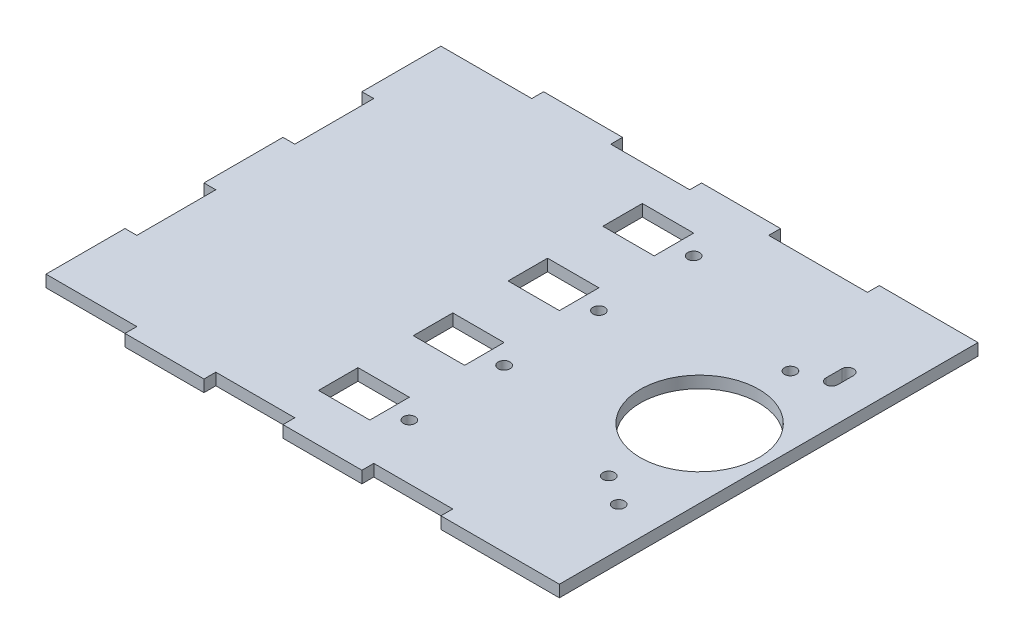
from build123d import *

# Parameters (mm, degrees)
SKETCH1_W            = 130
SKETCH1_H            = 100
BOSS_EXTRUDE1_DEPTH  = 3
SKETCH2_W            = 30
SKETCH2_H            = 3
BOSS_EXTRUDE2_DEPTH  = 3
SKETCH4_W            = 20
SKETCH4_H            = 3
BOSS_EXTRUDE3_DEPTH  = 3
SKETCH5_W            = 20
SKETCH5_H            = 3
BOSS_EXTRUDE4_DEPTH  = 3
SKETCH6_W            = 20
SKETCH6_H            = 3
BOSS_EXTRUDE5_DEPTH  = 3
SKETCH7_W            = 20
SKETCH7_H            = 3
BOSS_EXTRUDE6_DEPTH  = 3
SKETCH8_W            = 20
SKETCH8_H            = 3
BOSS_EXTRUDE7_DEPTH  = 3
SKETCH9_W            = 20
SKETCH9_H            = 3
BOSS_EXTRUDE8_DEPTH  = 3
SKETCH10_W           = 20
SKETCH10_H           = 3
BOSS_EXTRUDE9_DEPTH  = 3
SKETCH11_W           = 25
SKETCH11_H           = 3
BOSS_EXTRUDE10_DEPTH = 3
CUT_EXTRUDE1_DEPTH   = 0.5
SKETCH18_R           = 1.5
CUT_EXTRUDE2_DEPTH   = 10
SKETCH19_R           = 1.5
CUT_EXTRUDE3_DEPTH   = 10
SKETCH30_R           = 15
CUT_EXTRUDE9_DEPTH   = 3
SKETCH32_W           = 13
SKETCH32_H           = 10
CUT_EXTRUDE11_DEPTH  = 10
SKETCH34_R           = 1.5
CUT_EXTRUDE12_DEPTH  = 10
SKETCH35_R           = 1.5
CUT_EXTRUDE13_DEPTH  = 10


with BuildPart() as part:
    # Sketch1 → Boss-Extrude1 (new body)
    with BuildSketch(Plane(origin=(0, 0, 0), x_dir=(1, 0, 0), z_dir=(0, 1, 0))):
        with Locations((65, 50)):
            Rectangle(SKETCH1_W, SKETCH1_H)
    extrude(amount=BOSS_EXTRUDE1_DEPTH)

    # Sketch2 → Boss-Extrude2 (add)
    with BuildSketch(Plane.XY):
        with Locations((115, 1.5)):
            Rectangle(SKETCH2_W, SKETCH2_H)
    extrude(amount=BOSS_EXTRUDE2_DEPTH)

    # Sketch4 → Boss-Extrude3 (add)
    with BuildSketch(Plane.XY):
        with Locations((70, 1.5)):
            Rectangle(SKETCH4_W, SKETCH4_H)
    extrude(amount=BOSS_EXTRUDE3_DEPTH)

    # Sketch5 → Boss-Extrude4 (add)
    with BuildSketch(Plane.XY):
        with Locations((30, 1.5)):
            Rectangle(SKETCH5_W, SKETCH5_H)
    extrude(amount=BOSS_EXTRUDE4_DEPTH)

    # Sketch6 → Boss-Extrude5 (add)
    with BuildSketch(Plane.ZY):
        with Locations((-10, 1.5)):
            Rectangle(SKETCH6_W, SKETCH6_H)
    extrude(amount=BOSS_EXTRUDE5_DEPTH)

    # Sketch7 → Boss-Extrude6 (add)
    with BuildSketch(Plane.ZY):
        with Locations((-50, 1.5)):
            Rectangle(SKETCH7_W, SKETCH7_H)
    extrude(amount=BOSS_EXTRUDE6_DEPTH)

    # Sketch8 → Boss-Extrude7 (add)
    with BuildSketch(Plane.ZY):
        with Locations((-90, 1.5)):
            Rectangle(SKETCH8_W, SKETCH8_H)
    extrude(amount=BOSS_EXTRUDE7_DEPTH)

    # Sketch9 → Boss-Extrude8 (add)
    with BuildSketch(Plane(origin=(0, 0, -100), x_dir=(-1, 0, 0), z_dir=(0, 0, -1))):
        with Locations((-30, 1.5)):
            Rectangle(SKETCH9_W, SKETCH9_H)
    extrude(amount=BOSS_EXTRUDE8_DEPTH)

    # Sketch10 → Boss-Extrude9 (add)
    with BuildSketch(Plane(origin=(0, 0, -100), x_dir=(-1, 0, 0), z_dir=(0, 0, -1))):
        with Locations((-70, 1.5)):
            Rectangle(SKETCH10_W, SKETCH10_H)
    extrude(amount=BOSS_EXTRUDE9_DEPTH)

    # Sketch11 → Boss-Extrude10 (add)
    with BuildSketch(Plane(origin=(0, 0, -100), x_dir=(-1, 0, 0), z_dir=(0, 0, -1))):
        with Locations((-117.5, 1.5)):
            Rectangle(SKETCH11_W, SKETCH11_H)
    extrude(amount=BOSS_EXTRUDE10_DEPTH)

    # Sketch14 → Cut-Extrude1 (cut)
    # profile 1 of 11: a face of its own
    with BuildSketch(Plane.XZ):
        with BuildLine():
            Line((39.09778483, -56.542885003), (39.780677458, -56.542885003))
            add(Edge.make_bspline(
                [(39.780677458, -56.542885003), (39.814105936, -56.543060753), (39.878898647, -56.543401401), (39.973118088, -56.548684532), (40.061366899, -56.555888202), (40.143670671, -56.567318295), (40.219991374, -56.581110072), (40.290559011, -56.597811888), (40.355149183, -56.617838502), (40.43226192, -56.649684783), (40.520182581, -56.697007951), (40.615380973, -56.766936517), (40.696785213, -56.85246898), (40.76697153, -56.948951635), (40.82277265, -57.055087407), (40.863141947, -57.168346596), (40.888699822, -57.287268338), (40.891328256, -57.368911515), (40.892656625, -57.410172663)],
                knots=[0, 0, 0, 0, 1.001505555, 1.941167018, 2.826882275, 3.653841531, 4.429895133, 5.150066043, 5.825578002, 6.45369114, 7.647487171, 8.808567382, 9.977351308, 11.170798116, 12.373658725, 13.556498008, 14.765093433, 16, 16, 16, 16], degree=3))
            add(Edge.make_bspline(
                [(40.892656625, -57.410172663), (40.891563406, -57.448825219), (40.889415129, -57.524781136), (40.86887237, -57.635875245), (40.836711701, -57.741626464), (40.792006452, -57.841648849), (40.733904456, -57.933682463), (40.665046137, -58.018469729), (40.581969335, -58.092420786), (40.519726095, -58.133763688), (40.488109349, -58.154764009)],
                knots=[0, 0, 0, 0, 1.044552857, 2.05264487, 3.044412934, 4.028983338, 5.005914585, 5.980388656, 6.974128949, 8, 8, 8, 8], degree=3))
            add(Edge.make_bspline(
                [(40.488109349, -58.154764009), (40.527869777, -58.170029008), (40.603941324, -58.199234733), (40.708627336, -58.250870197), (40.798822181, -58.307032307), (40.875219327, -58.368364157), (40.940556982, -58.434472968), (40.997609924, -58.506328082), (41.046291298, -58.58486684), (41.088004222, -58.669270375), (41.120552978, -58.758676844), (41.144928882, -58.85224762), (41.158896331, -58.949647175), (41.160883973, -59.015932554), (41.161887394, -59.04939542)],
                knots=[0, 0, 0, 0, 1.27268992, 2.434971085, 3.483601985, 4.442670788, 5.356604649, 6.2567628, 7.179492994, 8.113709626, 9.066344395, 10.018646069, 10.999752585, 12, 12, 12, 12], degree=3))
            add(Edge.make_bspline(
                [(41.161887394, -59.04939542), (41.160910548, -59.083562292), (41.158988576, -59.15078657), (41.144808604, -59.249541704), (41.120799497, -59.343916651), (41.087728351, -59.434521834), (41.044566036, -59.521181968), (40.992038072, -59.603995232), (40.929406508, -59.682129563), (40.859343639, -59.756453186), (40.780081494, -59.823280973), (40.694565739, -59.88279668), (40.601719419, -59.931742742), (40.503067425, -59.972858763), (40.397503109, -60.004265962), (40.285500502, -60.026238536), (40.1671562, -60.041043573), (40.085946449, -60.042260778), (40.044299253, -60.042885003)],
                knots=[0, 0, 0, 0, 0.978564426, 1.925352924, 2.850884081, 3.763762016, 4.682927383, 5.618979971, 6.567305752, 7.547517671, 8.540179244, 9.531824382, 10.526200242, 11.540722885, 12.589160233, 13.674978461, 14.80764778, 16, 16, 16, 16], degree=3))
            Line((40.044299253, -60.042885003), (39.09778483, -60.042885003))
            Line((39.09778483, -60.042885003), (39.09778483, -56.542885003))
        make_face()
        with BuildLine():
            Line((39.411887394, -56.901859362), (39.411887394, -58.023654234))
            Line((39.411887394, -58.023654234), (39.622925054, -58.023654234))
            add(Edge.make_bspline(
                [(39.622925054, -58.023654234), (39.65377385, -58.023254311), (39.713380009, -58.022481578), (39.799699905, -58.020268061), (39.879824924, -58.014070017), (39.953616757, -58.007873755), (40.020959201, -57.997799168), (40.081703062, -57.985807045), (40.136801659, -57.97312414), (40.200341205, -57.951554653), (40.272414153, -57.919676978), (40.349247257, -57.870205141), (40.416981727, -57.811280788), (40.474178915, -57.743289827), (40.520990385, -57.668423641), (40.5535041, -57.58787676), (40.575551384, -57.503656628), (40.577542916, -57.445838375), (40.578554061, -57.416482759)],
                knots=[0, 0, 0, 0, 1.156816544, 2.235205308, 3.236616184, 4.169592532, 5.011045266, 5.787822928, 6.49130361, 7.128639758, 8.301311294, 9.436451833, 10.541879658, 11.654887649, 12.756523258, 13.837046038, 14.901820046, 16, 16, 16, 16], degree=3))
            add(Edge.make_bspline(
                [(40.578554061, -57.416482759), (40.57802788, -57.397056988), (40.576995721, -57.358951216), (40.568542418, -57.303401862), (40.554174844, -57.251158109), (40.53572055, -57.201503999), (40.509931862, -57.155992148), (40.479568398, -57.113048953), (40.442882708, -57.074136834), (40.401125395, -57.037767336), (40.353116772, -57.005522808), (40.298885481, -56.977282045), (40.237697804, -56.954541268), (40.170584949, -56.934625116), (40.096513861, -56.920636822), (40.016339308, -56.908983434), (39.929404589, -56.903050692), (39.869259486, -56.902265329), (39.838169445, -56.901859362)],
                knots=[0, 0, 0, 0, 0.91205012, 1.789085906, 2.630437955, 3.453916878, 4.269457761, 5.079663411, 5.91843418, 6.774407191, 7.675494373, 8.627863946, 9.638891023, 10.736472738, 11.911756761, 13.175263542, 14.539845004, 16, 16, 16, 16], degree=3))
            Line((39.838169445, -56.901859362), (39.411887394, -56.901859362))
        make_face(mode=Mode.SUBTRACT)
        with BuildLine():
            Line((39.411887394, -58.382628593), (39.411887394, -59.683910644))
            Line((39.411887394, -59.683910644), (39.859203099, -59.683910644))
            add(Edge.make_bspline(
                [(39.859203099, -59.683910644), (39.891222025, -59.683526897), (39.952934284, -59.682787274), (40.042035514, -59.680372719), (40.124618618, -59.674880444), (40.200306753, -59.666234594), (40.269917206, -59.656856145), (40.332614909, -59.644244864), (40.388908102, -59.629795903), (40.45418241, -59.607461731), (40.527685918, -59.57276526), (40.606896775, -59.520451034), (40.677322993, -59.458127726), (40.737128252, -59.385996812), (40.786141241, -59.307565485), (40.821796696, -59.224420135), (40.843787552, -59.137934608), (40.846449722, -59.078967895), (40.84778483, -59.04939542)],
                knots=[0, 0, 0, 0, 1.160039823, 2.235823828, 3.228722157, 4.157150951, 4.99529583, 5.772374946, 6.472645482, 7.099169577, 8.269452708, 9.405989375, 10.527446681, 11.663510218, 12.788923519, 13.866172445, 14.929861265, 16, 16, 16, 16], degree=3))
            add(Edge.make_bspline(
                [(40.84778483, -59.04939542), (40.847508726, -59.030902079), (40.84696097, -58.994213697), (40.838700356, -58.940297878), (40.826686486, -58.888072005), (40.811155052, -58.837394264), (40.788535585, -58.789180888), (40.76212904, -58.742478328), (40.731167638, -58.697224849), (40.682923472, -58.640012595), (40.612751488, -58.574095583), (40.513044712, -58.50955808), (40.399672414, -58.457510273), (40.317444921, -58.435410797), (40.274968323, -58.423994779)],
                knots=[0, 0, 0, 0, 0.723448775, 1.435228256, 2.130040452, 2.821711965, 3.505591119, 4.210454504, 4.921174351, 5.648778258, 7.137944449, 8.670945889, 10.280296675, 12, 12, 12, 12], degree=3))
            add(Edge.make_bspline(
                [(40.274968323, -58.423994779), (40.257939228, -58.420539695), (40.221016635, -58.41304836), (40.160809055, -58.405140656), (40.092073186, -58.398095597), (40.014650309, -58.392884439), (39.928442468, -58.387497895), (39.833265549, -58.385403074), (39.729508234, -58.382903814), (39.657515862, -58.38272268), (39.620120567, -58.382628593)],
                knots=[0, 0, 0, 0, 0.634451884, 1.375622551, 2.216452059, 3.157844607, 4.20941857, 5.370758133, 6.634282058, 8, 8, 8, 8], degree=3))
            Line((39.620120567, -58.382628593), (39.411887394, -58.382628593))
        make_face(mode=Mode.SUBTRACT)
    # profile 2 of 11: a face of its own
    with BuildSketch(Plane.XZ):
        with BuildLine():
            add(Edge.make_bspline(
                [(43.025469125, -57.4403209), (43.073460398, -57.441342791), (43.167559555, -57.44334647), (43.305367441, -57.464761436), (43.436912577, -57.4975088), (43.562698769, -57.542780362), (43.681115065, -57.603462313), (43.793886309, -57.675871604), (43.900703318, -57.761654198), (43.964726347, -57.828012266), (43.997223932, -57.861695099)],
                knots=[0, 0, 0, 0, 1.054011418, 2.066658804, 3.057071809, 4.030435133, 4.997543892, 5.974964718, 6.972108034, 8, 8, 8, 8], degree=3))
            add(Edge.make_bspline(
                [(43.997223932, -57.861695099), (44.025205886, -57.893909085), (44.080628267, -57.957713627), (44.151693986, -58.06116924), (44.212915546, -58.168309341), (44.261978507, -58.280556667), (44.30066353, -58.396931338), (44.328129227, -58.51783335), (44.344466162, -58.642995697), (44.346669128, -58.727999535), (44.34778483, -58.771050067)],
                knots=[0, 0, 0, 0, 1.025258237, 2.030674902, 3.01204498, 3.988269485, 4.97094183, 5.956517959, 6.965070386, 8, 8, 8, 8], degree=3))
            add(Edge.make_bspline(
                [(44.34778483, -58.771050067), (44.346803493, -58.814350125), (44.344864324, -58.899913058), (44.326520708, -59.025932424), (44.297989622, -59.148127246), (44.257157784, -59.26598594), (44.204799675, -59.379868768), (44.140908987, -59.489278317), (44.06503737, -59.59443045), (43.979033373, -59.694432288), (43.883981497, -59.786598503), (43.780865349, -59.866926773), (43.671711315, -59.935748297), (43.555067962, -59.991184713), (43.432000475, -60.034894413), (43.302243407, -60.065594429), (43.165998336, -60.084156113), (43.072971115, -60.086539687), (43.025469125, -60.087756798)],
                knots=[0, 0, 0, 0, 0.998656419, 1.973391657, 2.932242238, 3.890759089, 4.846373663, 5.82037756, 6.809684879, 7.83454468, 8.860553229, 9.859544525, 10.845671541, 11.83227036, 12.833544569, 13.85385346, 14.904124723, 16, 16, 16, 16], degree=3))
            add(Edge.make_bspline(
                [(43.025469125, -60.087756798), (42.977734405, -60.086535602), (42.884243546, -60.084143827), (42.747517564, -60.065666544), (42.617527945, -60.034908562), (42.494299346, -59.991041069), (42.377154499, -59.935746525), (42.267368002, -59.867134836), (42.164168087, -59.78657468), (42.069096102, -59.694438743), (41.983097497, -59.594428787), (41.907224489, -59.489278749), (41.843334162, -59.379868655), (41.790975959, -59.26598597), (41.750144146, -59.148127238), (41.721613053, -59.025932426), (41.703269438, -58.899913057), (41.70133027, -58.814350124), (41.700348932, -58.771050067)],
                knots=[0, 0, 0, 0, 1.099876186, 2.154163076, 3.173186993, 4.173200201, 5.163417411, 6.152872554, 7.150605724, 8.17532212, 9.198891216, 10.186952605, 11.159729845, 12.11414092, 13.071450619, 14.029093627, 15.002601286, 16, 16, 16, 16], degree=3))
            add(Edge.make_bspline(
                [(41.700348932, -58.771050067), (41.701472243, -58.728233521), (41.703696204, -58.643464119), (41.720016713, -58.518537058), (41.74737527, -58.397839669), (41.786106666, -58.281914193), (41.835621857, -58.170158757), (41.895983145, -58.062753926), (41.967773778, -57.959766125), (42.022975729, -57.896044045), (42.05090983, -57.863798464)],
                knots=[0, 0, 0, 0, 1.031353054, 2.041901799, 3.029428768, 4.008703097, 4.981709435, 5.96992636, 6.972712378, 8, 8, 8, 8], degree=3))
            add(Edge.make_bspline(
                [(42.05090983, -57.863798464), (42.083358421, -57.829823525), (42.147174285, -57.763005829), (42.254523012, -57.677473305), (42.367016834, -57.603557231), (42.48674176, -57.544081016), (42.612424618, -57.497242498), (42.74464386, -57.464676983), (42.882919376, -57.443423628), (42.977478997, -57.44136545), (43.025469125, -57.4403209)],
                knots=[0, 0, 0, 0, 1.027980169, 2.021703884, 2.998553061, 3.971491411, 4.943284454, 5.930300938, 6.949603206, 8, 8, 8, 8], degree=3))
        make_face()
        with BuildLine():
            add(Edge.make_bspline(
                [(43.024066881, -57.754423464), (42.99012927, -57.755388056), (42.923130141, -57.757292339), (42.824510556, -57.771776243), (42.729570403, -57.794723747), (42.638129558, -57.827327804), (42.550496386, -57.869426703), (42.466586984, -57.921135063), (42.386154544, -57.981768019), (42.31077248, -58.051230691), (42.241590168, -58.127109685), (42.181112192, -58.207958044), (42.129687085, -58.292464391), (42.086846926, -58.380716602), (42.054939738, -58.473609016), (42.031766716, -58.570089647), (42.017296475, -58.670355063), (42.015410097, -58.738516082), (42.014451497, -58.773153432)],
                knots=[0, 0, 0, 0, 1.021534396, 2.016698045, 2.994645724, 3.958388632, 4.93408049, 5.916473867, 6.921342795, 7.962252576, 8.998418191, 10.008913653, 10.997312074, 11.973003931, 12.956656626, 13.948281152, 14.957379055, 16, 16, 16, 16], degree=3))
            add(Edge.make_bspline(
                [(42.014451497, -58.773153432), (42.01605832, -58.81790546), (42.019247565, -58.906729865), (42.045182801, -59.037540988), (42.088569081, -59.16312284), (42.147156361, -59.282739226), (42.220562579, -59.393411504), (42.307049646, -59.492082988), (42.405689346, -59.5772688), (42.515305847, -59.647949645), (42.633660164, -59.704109401), (42.758916486, -59.743908377), (42.88955718, -59.769780069), (42.978837911, -59.772351543), (43.024066881, -59.773654234)],
                knots=[0, 0, 0, 0, 1.016792936, 2.018143844, 3.017858371, 4.030088057, 5.03801393, 6.028138512, 7.003788237, 7.991172063, 8.984598303, 9.972568034, 10.972917682, 12, 12, 12, 12], degree=3))
            add(Edge.make_bspline(
                [(43.024066881, -59.773654234), (43.06929325, -59.772343953), (43.158568846, -59.769757497), (43.289028023, -59.744038677), (43.413941995, -59.703935016), (43.532173382, -59.648012806), (43.641739986, -59.577000391), (43.741089107, -59.492564014), (43.826837718, -59.393150163), (43.900171323, -59.282592634), (43.959718066, -59.163308282), (44.002901268, -59.03751781), (44.028898853, -58.906735768), (44.032079682, -58.817907437), (44.033682266, -58.773153432)],
                knots=[0, 0, 0, 0, 1.02726834, 2.027799167, 3.010890988, 4.004497153, 4.992059811, 5.971914811, 6.958719428, 7.966827853, 8.981595046, 9.981490638, 10.983022906, 12, 12, 12, 12], degree=3))
            add(Edge.make_bspline(
                [(44.033682266, -58.773153432), (44.032723996, -58.738515875), (44.030838267, -58.670354449), (44.016363302, -58.570091995), (43.993207763, -58.473600399), (43.961236145, -58.380748395), (43.918582131, -58.292235891), (43.866165338, -58.208206164), (43.805934313, -58.126829618), (43.735917192, -58.051475977), (43.660613814, -57.981740941), (43.580148776, -57.921111551), (43.496363797, -57.869653956), (43.408985215, -57.826967715), (43.317532647, -57.795020375), (43.222725518, -57.771643743), (43.124526708, -57.757353547), (43.057767665, -57.755406405), (43.024066881, -57.754423464)],
                knots=[0, 0, 0, 0, 1.042956736, 2.052379634, 3.044323526, 4.02829302, 5.004299113, 5.996692471, 7.007513377, 8.048758398, 9.090003419, 10.095195979, 11.07790575, 12.047570684, 13.018257071, 13.989683339, 14.985167495, 16, 16, 16, 16], degree=3))
        make_face(mode=Mode.SUBTRACT)
    # profile 3 of 11: a face of its own
    with BuildSketch(Plane.XZ):
        Polygon((45.290092522, -56.453141413), (45.604195086, -56.453141413), (45.604195086, -57.485192695), (46.052913035, -57.485192695), (46.052913035, -57.799295259), (45.604195086, -57.799295259), (45.604195086, -60.042885003), (45.290092522, -60.042885003), (45.290092522, -57.799295259), (44.841374573, -57.799295259), (44.841374573, -57.485192695), (45.290092522, -57.485192695), align=None)
    # profile 4 of 11: a face of its own
    with BuildSketch(Plane.XZ):
        Polygon((46.905477138, -56.453141413), (47.219579702, -56.453141413), (47.219579702, -57.485192695), (47.66829765, -57.485192695), (47.66829765, -57.799295259), (47.219579702, -57.799295259), (47.219579702, -60.042885003), (46.905477138, -60.042885003), (46.905477138, -57.799295259), (46.456759189, -57.799295259), (46.456759189, -57.485192695), (46.905477138, -57.485192695), align=None)
    # profile 5 of 11: a face of its own
    with BuildSketch(Plane.XZ):
        with BuildLine():
            add(Edge.make_bspline(
                [(49.442135791, -57.4403209), (49.490127064, -57.441342791), (49.584226222, -57.44334647), (49.722034108, -57.464761436), (49.853579244, -57.4975088), (49.979365436, -57.542780362), (50.097781731, -57.603462313), (50.210552975, -57.675871604), (50.317369984, -57.761654198), (50.381393013, -57.828012266), (50.413890599, -57.861695099)],
                knots=[0, 0, 0, 0, 1.054011418, 2.066658804, 3.057071809, 4.030435133, 4.997543892, 5.974964718, 6.972108034, 8, 8, 8, 8], degree=3))
            add(Edge.make_bspline(
                [(50.413890599, -57.861695099), (50.441872553, -57.893909085), (50.497294933, -57.957713627), (50.568360652, -58.06116924), (50.629582212, -58.168309341), (50.678645173, -58.280556667), (50.717330197, -58.396931338), (50.744795893, -58.51783335), (50.761132828, -58.642995697), (50.763335795, -58.727999535), (50.764451497, -58.771050067)],
                knots=[0, 0, 0, 0, 1.025258237, 2.030674902, 3.01204498, 3.988269485, 4.97094183, 5.956517959, 6.965070386, 8, 8, 8, 8], degree=3))
            add(Edge.make_bspline(
                [(50.764451497, -58.771050067), (50.763470159, -58.814350125), (50.761530991, -58.899913058), (50.743187375, -59.025932424), (50.714656289, -59.148127246), (50.67382445, -59.26598594), (50.621466341, -59.379868768), (50.557575654, -59.489278317), (50.481704037, -59.59443045), (50.39570004, -59.694432288), (50.300648164, -59.786598503), (50.197532015, -59.866926773), (50.088377982, -59.935748297), (49.971734628, -59.991184713), (49.848667141, -60.034894413), (49.718910073, -60.065594429), (49.582665003, -60.084156113), (49.489637782, -60.086539687), (49.442135791, -60.087756798)],
                knots=[0, 0, 0, 0, 0.998656419, 1.973391657, 2.932242238, 3.890759089, 4.846373663, 5.82037756, 6.809684879, 7.83454468, 8.860553229, 9.859544525, 10.845671541, 11.83227036, 12.833544569, 13.85385346, 14.904124723, 16, 16, 16, 16], degree=3))
            add(Edge.make_bspline(
                [(49.442135791, -60.087756798), (49.394401072, -60.086535602), (49.300910212, -60.084143827), (49.16418423, -60.065666544), (49.034194611, -60.034908562), (48.910966013, -59.991041069), (48.793821166, -59.935746525), (48.684034669, -59.867134836), (48.580834753, -59.78657468), (48.485762769, -59.694438743), (48.399764164, -59.594428787), (48.323891155, -59.489278749), (48.260000829, -59.379868655), (48.207642625, -59.26598597), (48.166810812, -59.148127238), (48.13827972, -59.025932426), (48.119936105, -58.899913057), (48.117996937, -58.814350124), (48.117015599, -58.771050067)],
                knots=[0, 0, 0, 0, 1.099876186, 2.154163076, 3.173186993, 4.173200201, 5.163417411, 6.152872554, 7.150605724, 8.17532212, 9.198891216, 10.186952605, 11.159729845, 12.11414092, 13.071450619, 14.029093627, 15.002601286, 16, 16, 16, 16], degree=3))
            add(Edge.make_bspline(
                [(48.117015599, -58.771050067), (48.118138909, -58.728233521), (48.120362871, -58.643464119), (48.13668338, -58.518537058), (48.164041936, -58.397839669), (48.202773333, -58.281914193), (48.252288524, -58.170158757), (48.312649812, -58.062753926), (48.384440444, -57.959766125), (48.439642396, -57.896044045), (48.467576497, -57.863798464)],
                knots=[0, 0, 0, 0, 1.031353054, 2.041901799, 3.029428768, 4.008703097, 4.981709435, 5.96992636, 6.972712378, 8, 8, 8, 8], degree=3))
            add(Edge.make_bspline(
                [(48.467576497, -57.863798464), (48.500025088, -57.829823525), (48.563840951, -57.763005829), (48.671189679, -57.677473305), (48.7836835, -57.603557231), (48.903408426, -57.544081016), (49.029091284, -57.497242498), (49.161310527, -57.464676983), (49.299586042, -57.443423628), (49.394145663, -57.44136545), (49.442135791, -57.4403209)],
                knots=[0, 0, 0, 0, 1.027980169, 2.021703884, 2.998553061, 3.971491411, 4.943284454, 5.930300938, 6.949603206, 8, 8, 8, 8], degree=3))
        make_face()
        with BuildLine():
            add(Edge.make_bspline(
                [(49.440733548, -57.754423464), (49.406795936, -57.755388056), (49.339796808, -57.757292339), (49.241177223, -57.771776243), (49.146237069, -57.794723747), (49.054796225, -57.827327804), (48.967163053, -57.869426703), (48.88325365, -57.921135063), (48.80282121, -57.981768019), (48.727439147, -58.051230691), (48.658256835, -58.127109685), (48.597778858, -58.207958044), (48.546353752, -58.292464391), (48.503513593, -58.380716602), (48.471606405, -58.473609016), (48.448433382, -58.570089647), (48.433963142, -58.670355063), (48.432076763, -58.738516082), (48.431118163, -58.773153432)],
                knots=[0, 0, 0, 0, 1.021534396, 2.016698045, 2.994645724, 3.958388632, 4.93408049, 5.916473867, 6.921342795, 7.962252576, 8.998418191, 10.008913653, 10.997312074, 11.973003931, 12.956656626, 13.948281152, 14.957379055, 16, 16, 16, 16], degree=3))
            add(Edge.make_bspline(
                [(48.431118163, -58.773153432), (48.432724987, -58.81790546), (48.435914231, -58.906729865), (48.461849468, -59.037540988), (48.505235748, -59.16312284), (48.563823027, -59.282739226), (48.637229246, -59.393411504), (48.723716313, -59.492082988), (48.822356013, -59.5772688), (48.931972513, -59.647949645), (49.050326831, -59.704109401), (49.175583152, -59.743908377), (49.306223846, -59.769780069), (49.395504577, -59.772351543), (49.440733548, -59.773654234)],
                knots=[0, 0, 0, 0, 1.016792936, 2.018143844, 3.017858371, 4.030088057, 5.03801393, 6.028138512, 7.003788237, 7.991172063, 8.984598303, 9.972568034, 10.972917682, 12, 12, 12, 12], degree=3))
            add(Edge.make_bspline(
                [(49.440733548, -59.773654234), (49.485959917, -59.772343953), (49.575235513, -59.769757497), (49.70569469, -59.744038677), (49.830608661, -59.703935016), (49.948840049, -59.648012806), (50.058406652, -59.577000391), (50.157755774, -59.492564014), (50.243504385, -59.393150163), (50.31683799, -59.282592634), (50.376384732, -59.163308282), (50.419567934, -59.03751781), (50.44556552, -58.906735768), (50.448746349, -58.817907437), (50.450348932, -58.773153432)],
                knots=[0, 0, 0, 0, 1.02726834, 2.027799167, 3.010890988, 4.004497153, 4.992059811, 5.971914811, 6.958719428, 7.966827853, 8.981595046, 9.981490638, 10.983022906, 12, 12, 12, 12], degree=3))
            add(Edge.make_bspline(
                [(50.450348932, -58.773153432), (50.449390662, -58.738515875), (50.447504933, -58.670354449), (50.433029969, -58.570091995), (50.409874429, -58.473600399), (50.377902812, -58.380748395), (50.335248798, -58.292235891), (50.282832005, -58.208206164), (50.22260098, -58.126829618), (50.152583859, -58.051475977), (50.077280481, -57.981740941), (49.996815443, -57.921111551), (49.913030464, -57.869653956), (49.825651881, -57.826967715), (49.734199314, -57.795020375), (49.639392185, -57.771643743), (49.541193375, -57.757353547), (49.474434332, -57.755406405), (49.440733548, -57.754423464)],
                knots=[0, 0, 0, 0, 1.042956736, 2.052379634, 3.044323526, 4.02829302, 5.004299113, 5.996692471, 7.007513377, 8.048758398, 9.090003419, 10.095195979, 11.07790575, 12.047570684, 13.018257071, 13.989683339, 14.985167495, 16, 16, 16, 16], degree=3))
        make_face(mode=Mode.SUBTRACT)
    # profile 6 of 11: a face of its own
    with BuildSketch(Plane.XZ):
        with BuildLine():
            Line((51.392656625, -57.485192695), (51.706759189, -57.485192695))
            Line((51.706759189, -57.485192695), (51.706759189, -57.929703913))
            add(Edge.make_bspline(
                [(51.706759189, -57.929703913), (51.735043139, -57.890816311), (51.789237898, -57.816303938), (51.878103551, -57.718113654), (51.966879663, -57.634785499), (52.030813045, -57.591042628), (52.061526817, -57.570028432)],
                knots=[0, 0, 0, 0, 1.134379233, 2.173579362, 3.122582517, 4, 4, 4, 4], degree=3))
            add(Edge.make_bspline(
                [(52.061526817, -57.570028432), (52.103391479, -57.550023067), (52.186389379, -57.510361854), (52.317808604, -57.470128295), (52.452283273, -57.445403193), (52.543091487, -57.44202182), (52.588770407, -57.4403209)],
                knots=[0, 0, 0, 0, 1.014936303, 2.012140481, 3.000054389, 4, 4, 4, 4], degree=3))
            add(Edge.make_bspline(
                [(52.588770407, -57.4403209), (52.619663403, -57.441366191), (52.680798982, -57.443434765), (52.771383072, -57.456894801), (52.859241684, -57.480160974), (52.943855714, -57.512568297), (53.023576393, -57.551814984), (53.096665591, -57.597864692), (53.162289799, -57.649561768), (53.22041585, -57.709240701), (53.272684876, -57.778577299), (53.320763722, -57.859441548), (53.365188935, -57.953649209), (53.389810243, -58.02201575), (53.402772811, -58.058009202)],
                knots=[0, 0, 0, 0, 1.009824226, 1.998387844, 2.986035974, 3.974953746, 4.955485308, 5.885931332, 6.793869504, 7.679848016, 8.601185859, 9.625726857, 10.749998409, 12, 12, 12, 12], degree=3))
            add(Edge.make_bspline(
                [(53.402772811, -58.058009202), (53.416484062, -58.033284782), (53.443465879, -57.984630597), (53.488771516, -57.915772335), (53.536239313, -57.851365543), (53.586273806, -57.791359119), (53.638698393, -57.736049388), (53.693759793, -57.685253487), (53.751144574, -57.638753273), (53.830936814, -57.584430114), (53.934749422, -57.526728932), (54.065637536, -57.476700488), (54.201787708, -57.44578436), (54.294205406, -57.442154087), (54.340873772, -57.4403209)],
                knots=[0, 0, 0, 0, 0.86119277, 1.694706429, 2.50939023, 3.298075842, 4.073795165, 4.829715201, 5.57930267, 6.321991688, 7.768977793, 9.186738141, 10.579381044, 12, 12, 12, 12], degree=3))
            add(Edge.make_bspline(
                [(54.340873772, -57.4403209), (54.383755235, -57.441938121), (54.467678421, -57.445103179), (54.589855687, -57.469956653), (54.703797492, -57.5126343), (54.809274568, -57.570867936), (54.904434382, -57.64404712), (54.987150691, -57.731115957), (55.056921054, -57.83145858), (55.102499694, -57.925850569), (55.133414958, -58.009185902), (55.152476193, -58.080192193), (55.169315888, -58.158343746), (55.183297133, -58.243734008), (55.193515685, -58.336664616), (55.201086401, -58.436983492), (55.206210474, -58.544768603), (55.206572546, -58.619134104), (55.206759189, -58.657468336)],
                knots=[0, 0, 0, 0, 1.209669288, 2.367440248, 3.500751976, 4.631527125, 5.755587489, 6.87532382, 8.007944318, 9.190864318, 9.82315674, 10.514484317, 11.263564316, 12.079023757, 12.955305781, 13.901327259, 14.918167583, 16, 16, 16, 16], degree=3))
            Line((55.206759189, -58.657468336), (55.206759189, -60.042885003))
            Line((55.206759189, -60.042885003), (54.892656625, -60.042885003))
            Line((54.892656625, -60.042885003), (54.892656625, -58.656066093))
            add(Edge.make_bspline(
                [(54.892656625, -58.656066093), (54.892578742, -58.623345519), (54.892429063, -58.560461552), (54.889735431, -58.470209101), (54.884660117, -58.387940743), (54.878725478, -58.313768655), (54.870481669, -58.247519867), (54.859835737, -58.189327448), (54.848558057, -58.138733637), (54.829822066, -58.082647589), (54.799874174, -58.020777379), (54.754256694, -57.954053803), (54.696786588, -57.895973003), (54.630426432, -57.845554686), (54.554877987, -57.804561045), (54.471613264, -57.775285035), (54.381149212, -57.757162157), (54.318526424, -57.755356141), (54.286186272, -57.754423464)],
                knots=[0, 0, 0, 0, 1.253487763, 2.409012846, 3.458416907, 4.410876679, 5.259312806, 6.014470957, 6.676830364, 7.243083969, 8.276244668, 9.299465089, 10.325150304, 11.392391894, 12.482080715, 13.603491619, 14.762376348, 16, 16, 16, 16], degree=3))
            add(Edge.make_bspline(
                [(54.286186272, -57.754423464), (54.246516318, -57.755839622), (54.168113407, -57.758638487), (54.05366792, -57.78721236), (53.943696904, -57.830292611), (53.841481771, -57.892725068), (53.74745398, -57.967533432), (53.666554402, -58.056483028), (53.599722217, -58.157112954), (53.554468241, -58.250259657), (53.52587894, -58.333929101), (53.507002024, -58.407026473), (53.492318632, -58.49010804), (53.478548103, -58.582615531), (53.469560375, -58.685185712), (53.461392003, -58.797344113), (53.45757114, -58.919428072), (53.457036681, -59.004054761), (53.456759189, -59.047993176)],
                knots=[0, 0, 0, 0, 1.090531906, 2.155305635, 3.229839962, 4.33261226, 5.44038871, 6.529323825, 7.629011124, 8.757537029, 9.370236727, 10.061839251, 10.834451254, 11.692844982, 12.636905849, 13.66920014, 14.789842145, 16, 16, 16, 16], degree=3))
            Line((53.456759189, -59.047993176), (53.456759189, -60.042885003))
            Line((53.456759189, -60.042885003), (53.142656625, -60.042885003))
            Line((53.142656625, -60.042885003), (53.142656625, -58.742304073))
            add(Edge.make_bspline(
                [(53.142656625, -58.742304073), (53.142577194, -58.705610755), (53.142424377, -58.635016497), (53.139748059, -58.533782822), (53.134661438, -58.441701742), (53.128780889, -58.358880278), (53.120320711, -58.285468949), (53.110710949, -58.221074191), (53.099362338, -58.16585744), (53.080572453, -58.105294055), (53.051857985, -58.038573133), (53.005669723, -57.967432111), (52.948062143, -57.905164014), (52.880491267, -57.852005265), (52.804485585, -57.808063784), (52.720502184, -57.776404032), (52.629297271, -57.757979743), (52.566419565, -57.755631246), (52.534082907, -57.754423464)],
                knots=[0, 0, 0, 0, 1.320475261, 2.540461679, 3.643808994, 4.639130445, 5.527981419, 6.302341397, 6.981980563, 7.553956391, 8.582137848, 9.585246428, 10.591171744, 11.620968678, 12.668337649, 13.738356861, 14.836885341, 16, 16, 16, 16], degree=3))
            add(Edge.make_bspline(
                [(52.534082907, -57.754423464), (52.496066695, -57.755953924), (52.420301736, -57.759004077), (52.308999766, -57.786458351), (52.201514083, -57.829462425), (52.099559384, -57.889122245), (52.005885236, -57.963021323), (51.923876968, -58.049936219), (51.854934443, -58.148785252), (51.809202628, -58.240949769), (51.779704154, -58.322523044), (51.760108819, -58.391873992), (51.743269193, -58.46887424), (51.730755172, -58.553761351), (51.718674756, -58.645982445), (51.712844447, -58.745996935), (51.707172885, -58.853719022), (51.70690047, -58.928091568), (51.706759189, -58.966663048)],
                knots=[0, 0, 0, 0, 1.098833095, 2.189935336, 3.297829714, 4.440610912, 5.596351641, 6.740013378, 7.886572111, 9.072425424, 9.705826452, 10.395263256, 11.156850408, 11.985370555, 12.878090359, 13.847760091, 14.883794034, 16, 16, 16, 16], degree=3))
            Line((51.706759189, -58.966663048), (51.706759189, -60.042885003))
            Line((51.706759189, -60.042885003), (51.392656625, -60.042885003))
            Line((51.392656625, -60.042885003), (51.392656625, -57.485192695))
        make_face()
    # profile 7 of 11: a face of its own
    with BuildSketch(Plane.XZ):
        with BuildLine():
            Line((57.225989958, -57.485192695), (57.540092522, -57.485192695))
            Line((57.540092522, -57.485192695), (57.540092522, -58.671490772))
            add(Edge.make_bspline(
                [(57.540092522, -58.671490772), (57.540234427, -58.706313521), (57.540505885, -58.772927809), (57.542346825, -58.868782996), (57.546676919, -58.956199709), (57.552090744, -59.035228445), (57.55905288, -59.105855837), (57.56733624, -59.167835194), (57.576594662, -59.221869378), (57.585657376, -59.254412734), (57.58987217, -59.269547663)],
                knots=[0, 0, 0, 0, 1.388932606, 2.656963016, 3.823490214, 4.879454478, 5.816252168, 6.653371382, 7.373723809, 8, 8, 8, 8], degree=3))
            add(Edge.make_bspline(
                [(57.58987217, -59.269547663), (57.596633625, -59.288570534), (57.610015966, -59.326220795), (57.634289449, -59.3806098), (57.664317786, -59.430985083), (57.697177614, -59.479289156), (57.735077021, -59.524091142), (57.777536493, -59.565315386), (57.82313473, -59.604519477), (57.890889753, -59.650904269), (57.983549019, -59.700619599), (58.105201774, -59.743515418), (58.237106, -59.769151238), (58.328270719, -59.772125493), (58.37512858, -59.773654234)],
                knots=[0, 0, 0, 0, 0.725840625, 1.436591201, 2.137033971, 2.831655856, 3.53531722, 4.242432219, 4.957935707, 5.694543706, 7.190802206, 8.724350549, 10.316345118, 12, 12, 12, 12], degree=3))
            add(Edge.make_bspline(
                [(58.37512858, -59.773654234), (58.421982088, -59.772092985), (58.512634956, -59.769072258), (58.643089925, -59.744288719), (58.76234134, -59.70288303), (58.869192291, -59.645075618), (58.963158131, -59.574333556), (59.04146255, -59.491324747), (59.106069804, -59.39867536), (59.134279225, -59.329551081), (59.14846592, -59.294788048)],
                knots=[0, 0, 0, 0, 1.157059328, 2.238695713, 3.266970494, 4.264342957, 5.228770407, 6.160125903, 7.074715775, 8, 8, 8, 8], degree=3))
            add(Edge.make_bspline(
                [(59.14846592, -59.294788048), (59.15266015, -59.280821749), (59.161932568, -59.249945674), (59.17189492, -59.197565925), (59.180869381, -59.135101321), (59.188532557, -59.062143112), (59.19399772, -58.97888196), (59.196943746, -58.885343883), (59.200272022, -58.781822523), (59.200322538, -58.709354764), (59.200348932, -58.671490772)],
                knots=[0, 0, 0, 0, 0.557542046, 1.232589297, 2.036731608, 2.971723315, 4.038036528, 5.22795436, 6.551621927, 8, 8, 8, 8], degree=3))
            Line((59.200348932, -58.671490772), (59.200348932, -57.485192695))
            Line((59.200348932, -57.485192695), (59.514451497, -57.485192695))
            Line((59.514451497, -57.485192695), (59.514451497, -58.730385003))
            add(Edge.make_bspline(
                [(59.514451497, -58.730385003), (59.514009802, -58.772692174), (59.513152853, -58.854773874), (59.50764551, -58.974057986), (59.498195897, -59.085220231), (59.483853212, -59.18831945), (59.466987538, -59.283276932), (59.445231265, -59.370214378), (59.419253027, -59.448863932), (59.389947512, -59.520605709), (59.355325644, -59.585652603), (59.318498624, -59.64738842), (59.275973852, -59.704281355), (59.231203618, -59.759163492), (59.181401962, -59.80930502), (59.127502103, -59.855856495), (59.070262683, -59.899529527), (59.008413485, -59.938620807), (58.942857422, -59.973837452), (58.873513565, -60.00505353), (58.799532567, -60.029756107), (58.72186893, -60.051066773), (58.640142151, -60.067781242), (58.554431018, -60.079567809), (58.464764401, -60.08679314), (58.403654942, -60.087430185), (58.372324093, -60.087756798)],
                knots=[0, 0, 0, 0, 1.493040784, 2.896703357, 4.213163133, 5.428574705, 6.569057535, 7.615249723, 8.588095153, 9.490268104, 10.346124644, 11.18633936, 12.024365274, 12.850166724, 13.684164916, 14.514361689, 15.362232829, 16.222528818, 17.093394965, 17.986930858, 18.902426812, 19.842810585, 20.827885679, 21.843828298, 22.894529745, 24, 24, 24, 24], degree=3))
            add(Edge.make_bspline(
                [(58.372324093, -60.087756798), (58.341227579, -60.087417091), (58.280120034, -60.086749534), (58.190448789, -60.079607727), (58.104500183, -60.067799556), (58.022579784, -60.050944339), (57.944605387, -60.029905269), (57.870261147, -60.004901733), (57.800417584, -59.973821252), (57.73423558, -59.938843694), (57.672233192, -59.899278419), (57.614124614, -59.855910379), (57.559987761, -59.808804316), (57.509810693, -59.758156959), (57.464297717, -59.703340022), (57.422881675, -59.644794462), (57.38492497, -59.583100374), (57.35057218, -59.517037211), (57.321060424, -59.444465201), (57.295005178, -59.364168104), (57.27369454, -59.275265587), (57.256352071, -59.177833659), (57.242400631, -59.072338617), (57.232714489, -58.958170202), (57.227298658, -58.83560651), (57.226435596, -58.75095662), (57.225989958, -58.707247984)],
                knots=[0, 0, 0, 0, 1.083640291, 2.129454052, 3.13281866, 4.105697902, 5.042300162, 5.946461698, 6.836384745, 7.703652036, 8.553297018, 9.397182691, 10.228592656, 11.052265423, 11.879314572, 12.708807002, 13.549817954, 14.402308542, 15.300838682, 16.27712199, 17.341985831, 18.484375296, 19.725102775, 21.0496083, 22.476576903, 24, 24, 24, 24], degree=3))
            Line((57.225989958, -58.707247984), (57.225989958, -57.485192695))
        make_face()
    # profile 8 of 11: a face of its own
    with BuildSketch(Plane.XZ):
        with BuildLine():
            Line((60.232400214, -57.485192695), (60.546502779, -57.485192695))
            Line((60.546502779, -57.485192695), (60.546502779, -57.946530836))
            add(Edge.make_bspline(
                [(60.546502779, -57.946530836), (60.580040414, -57.904688113), (60.645121365, -57.82349085), (60.753505698, -57.716770275), (60.868049598, -57.62882505), (60.988051602, -57.558721256), (61.113674612, -57.50587463), (61.244152882, -57.467708699), (61.380267588, -57.444823871), (61.472832025, -57.44183364), (61.51965983, -57.4403209)],
                knots=[0, 0, 0, 0, 1.12780773, 2.188550248, 3.19190651, 4.159438251, 5.104880172, 6.052711206, 7.014878035, 8, 8, 8, 8], degree=3))
            add(Edge.make_bspline(
                [(61.51965983, -57.4403209), (61.566990464, -57.442066096), (61.659627932, -57.445481864), (61.794505993, -57.472498555), (61.920479387, -57.51864381), (62.037098943, -57.581855881), (62.142226156, -57.660462354), (62.234551007, -57.752040136), (62.310914255, -57.857376219), (62.362111618, -57.955099375), (62.395837266, -58.04178817), (62.417069603, -58.11603492), (62.435100584, -58.198753071), (62.450732332, -58.28969266), (62.461309444, -58.38949085), (62.469651736, -58.497738542), (62.47563043, -58.614400673), (62.475867637, -58.6950873), (62.475989958, -58.736695099)],
                knots=[0, 0, 0, 0, 1.235846778, 2.418850247, 3.575807741, 4.728682307, 5.871620074, 6.994088408, 8.11269785, 9.256955736, 9.865816715, 10.540099792, 11.271859618, 12.076849838, 12.949306005, 13.892391288, 14.913166135, 16, 16, 16, 16], degree=3))
            Line((62.475989958, -58.736695099), (62.475989958, -60.042885003))
            Line((62.475989958, -60.042885003), (62.161887394, -60.042885003))
            Line((62.161887394, -60.042885003), (62.161887394, -58.839760003))
            add(Edge.make_bspline(
                [(62.161887394, -58.839760003), (62.161694186, -58.804937558), (62.161324612, -58.738328147), (62.160158965, -58.642959124), (62.157349159, -58.556472546), (62.153400846, -58.479075178), (62.147621815, -58.410841342), (62.141599184, -58.351632065), (62.134234207, -58.301522522), (62.127671294, -58.27135744), (62.124727939, -58.257828913)],
                knots=[0, 0, 0, 0, 1.430800155, 2.736877192, 3.918605307, 4.986035426, 5.920637409, 6.731861385, 7.431261377, 8, 8, 8, 8], degree=3))
            add(Edge.make_bspline(
                [(62.124727939, -58.257828913), (62.114102407, -58.218117728), (62.093651547, -58.141685984), (62.043117564, -58.038011631), (61.979303383, -57.949813443), (61.901405533, -57.877636721), (61.810176458, -57.821465885), (61.705869315, -57.78249193), (61.589490674, -57.758115661), (61.507636292, -57.755688529), (61.46497233, -57.754423464)],
                knots=[0, 0, 0, 0, 1.084156227, 2.086665306, 3.027808233, 3.945421172, 4.874247719, 5.839848303, 6.874090471, 8, 8, 8, 8], degree=3))
            add(Edge.make_bspline(
                [(61.46497233, -57.754423464), (61.439704646, -57.754899469), (61.389700553, -57.75584147), (61.315550581, -57.765292768), (61.243626408, -57.780751224), (61.173206199, -57.801619861), (61.105698405, -57.83028213), (61.038934114, -57.862811501), (60.97542735, -57.903359713), (60.913823953, -57.948550334), (60.856511145, -57.998629541), (60.803182807, -58.051474051), (60.755644787, -58.107749655), (60.712576111, -58.166549603), (60.675397848, -58.228681441), (60.64294476, -58.293545747), (60.615409065, -58.361227896), (60.601726373, -58.408202957), (60.594880182, -58.431707118)],
                knots=[0, 0, 0, 0, 1.023777757, 2.026029729, 3.023749952, 4.003683103, 4.997618607, 5.993177895, 7.010360494, 8.046726602, 9.087585522, 10.09234134, 11.086953743, 12.070360549, 13.043493632, 14.017870808, 15.008233677, 16, 16, 16, 16], degree=3))
            add(Edge.make_bspline(
                [(60.594880182, -58.431707118), (60.590940534, -58.448962321), (60.582364125, -58.486525996), (60.573100945, -58.548170415), (60.56469337, -58.61948039), (60.557656411, -58.700372707), (60.553350995, -58.791130582), (60.548656598, -58.89136642), (60.546947537, -59.001479908), (60.546655183, -59.078141601), (60.546502779, -59.118105355)],
                knots=[0, 0, 0, 0, 0.615963638, 1.340920617, 2.168419149, 3.115676021, 4.16674242, 5.331190069, 6.6087489, 8, 8, 8, 8], degree=3))
            Line((60.546502779, -59.118105355), (60.546502779, -60.042885003))
            Line((60.546502779, -60.042885003), (60.232400214, -60.042885003))
            Line((60.232400214, -60.042885003), (60.232400214, -57.485192695))
        make_face()
    # profile 9 of 11: a face of its own
    with BuildSketch(Plane.XZ):
        with BuildLine():
            Line((65.796502779, -56.453141413), (65.796502779, -60.042885003))
            Line((65.796502779, -60.042885003), (65.482400214, -60.042885003))
            Line((65.482400214, -60.042885003), (65.482400214, -59.60047715))
            add(Edge.make_bspline(
                [(65.482400214, -59.60047715), (65.446981424, -59.640516744), (65.377861209, -59.718654515), (65.262420091, -59.820736688), (65.140051913, -59.905115009), (65.011350592, -59.973264925), (64.876432348, -60.024456981), (64.735596261, -60.060843141), (64.58878488, -60.084236976), (64.488532525, -60.086572998), (64.43772874, -60.087756798)],
                knots=[0, 0, 0, 0, 1.074387032, 2.096679803, 3.090159297, 4.057316773, 5.018401886, 5.985159533, 6.978961417, 8, 8, 8, 8], degree=3))
            add(Edge.make_bspline(
                [(64.43772874, -60.087756798), (64.392560786, -60.086530425), (64.303487581, -60.084111965), (64.172458504, -60.065349661), (64.046366255, -60.03521904), (63.925091682, -59.99331815), (63.809419537, -59.937737329), (63.69835944, -59.871196081), (63.592486748, -59.791955251), (63.493415209, -59.701367222), (63.402183209, -59.602972235), (63.322121936, -59.498026688), (63.255368856, -59.386984384), (63.199548775, -59.27125123), (63.156552431, -59.149936311), (63.126578797, -59.023459143), (63.10783835, -58.891969269), (63.105420889, -58.802429746), (63.104195086, -58.757027631)],
                knots=[0, 0, 0, 0, 1.033919861, 2.038935746, 3.024066025, 3.998881131, 4.97069526, 5.957263378, 6.95902576, 7.993208707, 9.027059324, 10.027763471, 11.009749337, 11.988697705, 12.965288445, 13.950418724, 14.960734635, 16, 16, 16, 16], degree=3))
            add(Edge.make_bspline(
                [(63.104195086, -58.757027631), (63.105448058, -58.712563928), (63.107925114, -58.624661584), (63.126378334, -58.495382886), (63.157409343, -58.370864625), (63.200957191, -58.251507682), (63.256799146, -58.137167632), (63.324727233, -58.027763607), (63.404746357, -57.92299421), (63.496998764, -57.825322983), (63.596933535, -57.735102369), (63.703842265, -57.656693323), (63.815065547, -57.588976474), (63.932328557, -57.535322998), (64.053895662, -57.491913893), (64.180849108, -57.461880925), (64.312660687, -57.444183604), (64.402151179, -57.44162084), (64.447544445, -57.4403209)],
                knots=[0, 0, 0, 0, 1.020392517, 2.01726096, 2.990465484, 3.961182959, 4.928053699, 5.906110375, 6.912531644, 7.948652711, 8.985773172, 9.998621852, 10.987621588, 11.969261332, 12.953316658, 13.946091881, 14.958173133, 16, 16, 16, 16], degree=3))
            add(Edge.make_bspline(
                [(64.447544445, -57.4403209), (64.499761253, -57.441887996), (64.602257044, -57.444964032), (64.752155565, -57.470670399), (64.893943176, -57.513833277), (65.028436163, -57.572924558), (65.154832723, -57.649725309), (65.274059364, -57.742476757), (65.384042687, -57.853803903), (65.449114509, -57.937415477), (65.482400214, -57.980184682)],
                knots=[0, 0, 0, 0, 1.031072012, 2.023879775, 2.993683497, 3.952812103, 4.918022106, 5.908088563, 6.929940113, 8, 8, 8, 8], degree=3))
            Line((65.482400214, -57.980184682), (65.482400214, -56.453141413))
            Line((65.482400214, -56.453141413), (65.796502779, -56.453141413))
        make_face()
        with BuildLine():
            add(Edge.make_bspline(
                [(64.451751176, -57.754423464), (64.405836838, -57.756057102), (64.315209238, -57.759281643), (64.182165236, -57.784455138), (64.054851822, -57.826339733), (63.933905748, -57.883621634), (63.821237531, -57.955650371), (63.72054386, -58.042771754), (63.631001159, -58.142608768), (63.555692895, -58.254710878), (63.494302398, -58.374888969), (63.451135366, -58.500513408), (63.422666118, -58.629318385), (63.419757598, -58.716681071), (63.41829765, -58.76053324)],
                knots=[0, 0, 0, 0, 1.031046209, 2.035121221, 3.029706178, 4.034933723, 5.034054252, 6.02443088, 7.017295772, 8.038157696, 9.050218397, 10.03989886, 11.016116709, 12, 12, 12, 12], degree=3))
            add(Edge.make_bspline(
                [(63.41829765, -58.76053324), (63.420162544, -58.804123347), (63.423885021, -58.891132703), (63.450635715, -59.02011328), (63.495515588, -59.145767322), (63.556757651, -59.267028315), (63.633444276, -59.379612416), (63.722332928, -59.481352538), (63.82428321, -59.568842127), (63.937210717, -59.6420797), (64.057818687, -59.701242221), (64.184652619, -59.742407861), (64.315328257, -59.768985641), (64.404180591, -59.772090118), (64.448946689, -59.773654234)],
                knots=[0, 0, 0, 0, 0.979072187, 1.954306742, 2.945804271, 3.96968567, 4.997920485, 5.998718438, 6.996577872, 8.005894225, 9.015743152, 10.005417472, 10.995077863, 12, 12, 12, 12], degree=3))
            add(Edge.make_bspline(
                [(64.448946689, -59.773654234), (64.494393192, -59.77199427), (64.584781778, -59.768692766), (64.718220486, -59.743411501), (64.847715449, -59.701642702), (64.971502677, -59.643743576), (65.086818808, -59.57198622), (65.190316686, -59.487979129), (65.277832654, -59.390275945), (65.352025264, -59.282899492), (65.410200681, -59.165187495), (65.45257674, -59.039853304), (65.477630646, -58.906892556), (65.480788375, -58.816028629), (65.482400214, -58.769647823)],
                knots=[0, 0, 0, 0, 1.01762866, 2.023962475, 3.030623092, 4.058876274, 5.077231937, 6.066672613, 7.034107872, 8.005628644, 8.981990164, 9.965428785, 10.961468474, 12, 12, 12, 12], degree=3))
            add(Edge.make_bspline(
                [(65.482400214, -58.769647823), (65.481440558, -58.734309993), (65.479551651, -58.66475396), (65.465121081, -58.562626442), (65.442166155, -58.464892716), (65.409819985, -58.371450027), (65.3673287, -58.282815011), (65.316080934, -58.198351251), (65.255175485, -58.11849804), (65.185592789, -58.044354969), (65.109427586, -57.976728507), (65.028833045, -57.916364266), (64.942854298, -57.866775493), (64.852937262, -57.825734222), (64.758925927, -57.793075072), (64.660055307, -57.771287378), (64.55737632, -57.756327057), (64.487330265, -57.755064676), (64.451751176, -57.754423464)],
                knots=[0, 0, 0, 0, 1.050140795, 2.067009409, 3.05949893, 4.030605086, 5.00011959, 5.97591094, 6.962425594, 7.979863591, 8.993523472, 9.986985069, 10.967611495, 11.937549037, 12.921786183, 13.919465291, 14.943216303, 16, 16, 16, 16], degree=3))
        make_face(mode=Mode.SUBTRACT)
    # profile 10 of 11: a face of its own
    with BuildSketch(Plane.XZ):
        with BuildLine():
            Line((68.61361015, -59.235192695), (68.892656625, -59.38172715))
            add(Edge.make_bspline(
                [(68.892656625, -59.38172715), (68.870420029, -59.421170482), (68.827156421, -59.497911584), (68.752755673, -59.603343445), (68.674763601, -59.698191161), (68.589659633, -59.779920815), (68.499989954, -59.8511722), (68.405257299, -59.913510025), (68.304968481, -59.966628545), (68.199118756, -60.011381073), (68.086819205, -60.045790567), (67.967797689, -60.070094788), (67.841826193, -60.085118057), (67.755480013, -60.086863197), (67.7112664, -60.087756798)],
                knots=[0, 0, 0, 0, 1.120438281, 2.179929193, 3.190490725, 4.156257408, 5.095198341, 6.022838206, 6.959905092, 7.901321166, 8.864066838, 9.862729781, 10.905609505, 12, 12, 12, 12], degree=3))
            add(Edge.make_bspline(
                [(67.7112664, -60.087756798), (67.662124423, -60.086609622), (67.566262661, -60.084371816), (67.426722914, -60.065079351), (67.295343496, -60.033606993), (67.172131792, -59.989641451), (67.05738954, -59.932214127), (66.950888685, -59.862254645), (66.852069159, -59.78012239), (66.76404495, -59.685105947), (66.684801067, -59.58342399), (66.614875247, -59.477468105), (66.556417816, -59.367504881), (66.508865206, -59.254234357), (66.470460341, -59.138370463), (66.443693637, -59.018858996), (66.428263889, -58.896023411), (66.425899444, -58.812926076), (66.424707907, -58.771050067)],
                knots=[0, 0, 0, 0, 1.145258523, 2.234067595, 3.276747158, 4.290159414, 5.277019952, 6.260822364, 7.254936242, 8.264827045, 9.274100331, 10.257902744, 11.220704747, 12.172965371, 13.118907548, 14.062713208, 15.023725156, 16, 16, 16, 16], degree=3))
            add(Edge.make_bspline(
                [(66.424707907, -58.771050067), (66.425767048, -58.731755237), (66.427866126, -58.653878072), (66.441096914, -58.538612527), (66.464545207, -58.426584075), (66.496721531, -58.317699627), (66.538272777, -58.212141493), (66.589104996, -58.109845429), (66.649297374, -58.010920289), (66.695770048, -57.948517156), (66.719179061, -57.917083721)],
                knots=[0, 0, 0, 0, 1.024358464, 2.0301432, 3.019427413, 4.004406732, 4.986367066, 5.972626655, 6.978780325, 8, 8, 8, 8], degree=3))
            add(Edge.make_bspline(
                [(66.719179061, -57.917083721), (66.750886743, -57.879214851), (66.81329769, -57.8046767), (66.918854045, -57.706738375), (67.033154242, -57.624694599), (67.154765868, -57.556687463), (67.285102342, -57.505013816), (67.422411633, -57.466506234), (67.568257219, -57.444928223), (67.66796244, -57.441880389), (67.71897874, -57.4403209)],
                knots=[0, 0, 0, 0, 1.030682036, 2.02871468, 2.997146059, 3.962720338, 4.930598197, 5.918074684, 6.934738563, 8, 8, 8, 8], degree=3))
            add(Edge.make_bspline(
                [(67.71897874, -57.4403209), (67.771426345, -57.441674949), (67.874316591, -57.444331284), (68.024348712, -57.468957618), (68.166309429, -57.508010172), (68.300141933, -57.563163963), (68.425859794, -57.634323515), (68.542645844, -57.722465356), (68.652497356, -57.824883443), (68.716405935, -57.903646653), (68.748926657, -57.943726349)],
                knots=[0, 0, 0, 0, 1.056321875, 2.072262726, 3.055038591, 4.01806755, 4.982017516, 5.957941055, 6.960871419, 8, 8, 8, 8], degree=3))
            add(Edge.make_bspline(
                [(68.748926657, -57.943726349), (68.771053595, -57.97392993), (68.815160188, -58.034136049), (68.870407288, -58.132307206), (68.918364683, -58.235017801), (68.956697644, -58.343928098), (68.987737145, -58.457747678), (69.010193964, -58.577290223), (69.023363583, -58.702520134), (69.02595228, -58.787846689), (69.027272009, -58.831346541)],
                knots=[0, 0, 0, 0, 0.94817472, 1.890038105, 2.849395472, 3.817997239, 4.812318967, 5.836947057, 6.897266129, 8, 8, 8, 8], degree=3))
            Line((69.027272009, -58.831346541), (66.738810471, -58.831346541))
            add(Edge.make_bspline(
                [(66.738810471, -58.831346541), (66.740350077, -58.865047006), (66.743377651, -58.931317609), (66.757492794, -59.028288392), (66.779741568, -59.120661735), (66.811010631, -59.207744777), (66.848877476, -59.290674904), (66.895263193, -59.368836941), (66.950602747, -59.441874871), (67.012328446, -59.510442009), (67.081035542, -59.57150277), (67.153318289, -59.626154546), (67.230211854, -59.671960143), (67.311109937, -59.709140033), (67.395881722, -59.738246349), (67.484553918, -59.758114169), (67.576952034, -59.771421276), (67.639937768, -59.772900941), (67.67200358, -59.773654234)],
                knots=[0, 0, 0, 0, 1.094153842, 2.151609401, 3.174256925, 4.172055639, 5.149267565, 6.128595816, 7.11444997, 8.118368179, 9.117203808, 10.09244225, 11.054858984, 12.015122123, 12.976791628, 13.957293641, 14.960065497, 16, 16, 16, 16], degree=3))
            add(Edge.make_bspline(
                [(67.67200358, -59.773654234), (67.703354727, -59.773046177), (67.765561418, -59.771839676), (67.858202276, -59.760107765), (67.949341803, -59.741137489), (68.038602786, -59.715247499), (68.124173632, -59.683670647), (68.203419182, -59.64556779), (68.276299398, -59.603418043), (68.344416365, -59.555208368), (68.410487358, -59.496200181), (68.476029844, -59.42256446), (68.546306498, -59.335476932), (68.59029609, -59.269931266), (68.61361015, -59.235192695)],
                knots=[0, 0, 0, 0, 0.99110716, 1.966546729, 2.947904876, 3.932708344, 4.903319531, 5.828989031, 6.710028674, 7.56322171, 8.463672341, 9.504779593, 10.677557249, 12, 12, 12, 12], degree=3))
        make_face()
        with BuildLine():
            add(Edge.make_bspline(
                [(68.713169445, -58.517243977), (68.701672821, -58.475581104), (68.679545519, -58.395393483), (68.633309155, -58.284352592), (68.581237614, -58.185664691), (68.519615883, -58.100085058), (68.449797157, -58.024081545), (68.369151974, -57.95766296), (68.278716081, -57.898245509), (68.17895694, -57.84809301), (68.073315155, -57.805403151), (67.962708963, -57.776778035), (67.849851175, -57.757168493), (67.773516889, -57.755342385), (67.735104541, -57.754423464)],
                knots=[0, 0, 0, 0, 1.154881502, 2.222775134, 3.210006277, 4.132804581, 5.035138423, 5.962687519, 6.919655026, 7.923214229, 8.944639381, 9.960483929, 10.97369054, 12, 12, 12, 12], degree=3))
            add(Edge.make_bspline(
                [(67.735104541, -57.754423464), (67.703755103, -57.755035136), (67.641783854, -57.756244282), (67.550482786, -57.767714411), (67.462803087, -57.786674256), (67.378097799, -57.812639213), (67.297476931, -57.847247815), (67.219282163, -57.887831042), (67.145501766, -57.937372626), (67.099360471, -57.975131481), (67.076050054, -57.994207118)],
                knots=[0, 0, 0, 0, 1.04873581, 2.073130211, 3.073294108, 4.04793562, 5.032784715, 6.005352987, 6.992311501, 8, 8, 8, 8], degree=3))
            add(Edge.make_bspline(
                [(67.076050054, -57.994207118), (67.059356772, -58.009301434), (67.025573638, -58.03984865), (66.980433117, -58.092477856), (66.937212644, -58.149229419), (66.897878991, -58.212274543), (66.861801405, -58.280895322), (66.828041427, -58.354512957), (66.797655015, -58.433686088), (66.780558905, -58.488858527), (66.771763195, -58.517243977)],
                knots=[0, 0, 0, 0, 0.879870761, 1.780643979, 2.707998968, 3.669668524, 4.684282772, 5.740141944, 6.837334558, 8, 8, 8, 8], degree=3))
            Line((66.771763195, -58.517243977), (68.713169445, -58.517243977))
        make_face(mode=Mode.SUBTRACT)
    # profile 11 of 11: a face of its own
    with BuildSketch(Plane.XZ):
        with BuildLine():
            Line((69.565733548, -57.485192695), (69.879836112, -57.485192695))
            Line((69.879836112, -57.485192695), (69.879836112, -57.861695099))
            add(Edge.make_bspline(
                [(69.879836112, -57.861695099), (69.903024871, -57.826639271), (69.947373192, -57.759595271), (70.021086121, -57.67092597), (70.096589452, -57.597510924), (70.17424464, -57.539007405), (70.254622739, -57.495194286), (70.335959691, -57.463101251), (70.419535161, -57.444123936), (70.475697085, -57.441590277), (70.503834509, -57.4403209)],
                knots=[0, 0, 0, 0, 1.2804753, 2.448899062, 3.506932113, 4.484331642, 5.4025378, 6.288909075, 7.142734305, 8, 8, 8, 8], degree=3))
            add(Edge.make_bspline(
                [(70.503834509, -57.4403209), (70.525660836, -57.441511427), (70.570569921, -57.443961013), (70.638552511, -57.461171837), (70.708595963, -57.48864986), (70.75373835, -57.514490083), (70.777272009, -57.527961125)],
                knots=[0, 0, 0, 0, 0.901110191, 1.854092781, 2.881294221, 4, 4, 4, 4], degree=3))
            Line((70.777272009, -57.527961125), (70.604796048, -57.799996381))
            add(Edge.make_bspline(
                [(70.604796048, -57.799996381), (70.589687027, -57.793256115), (70.561007212, -57.7804618), (70.519052646, -57.765319789), (70.480371309, -57.756403874), (70.455727751, -57.755053156), (70.444239157, -57.754423464)],
                knots=[0, 0, 0, 0, 1.180555205, 2.24091978, 3.179933427, 4, 4, 4, 4], degree=3))
            add(Edge.make_bspline(
                [(70.444239157, -57.754423464), (70.419033423, -57.756103502), (70.367621033, -57.759530291), (70.292136534, -57.786469099), (70.218889328, -57.829994339), (70.160717666, -57.878265451), (70.115675413, -57.924813248), (70.083535188, -57.965461651), (70.054052441, -58.011040282), (70.02588222, -58.060769966), (70.000215926, -58.115499812), (69.976261257, -58.174683026), (69.954602394, -58.238388154), (69.94225215, -58.282770675), (69.935925856, -58.305505195)],
                knots=[0, 0, 0, 0, 1.125678352, 2.296057538, 3.5422874, 4.923748041, 5.663163013, 6.437101912, 7.23742474, 8.08941207, 8.991984279, 9.93940061, 10.944477711, 12, 12, 12, 12], degree=3))
            add(Edge.make_bspline(
                [(69.935925856, -58.305505195), (69.931193462, -58.325782369), (69.92071157, -58.370694767), (69.910520033, -58.446043292), (69.900450515, -58.535066951), (69.893353896, -58.638013544), (69.886775854, -58.754625988), (69.883065772, -58.885081933), (69.879962631, -59.029515284), (69.879879564, -59.130489638), (69.879836112, -59.183309682)],
                knots=[0, 0, 0, 0, 0.566838948, 1.255505196, 2.06880316, 3.007127437, 4.065329342, 5.249902469, 6.561414163, 8, 8, 8, 8], degree=3))
            Line((69.879836112, -59.183309682), (69.879836112, -60.042885003))
            Line((69.879836112, -60.042885003), (69.565733548, -60.042885003))
            Line((69.565733548, -60.042885003), (69.565733548, -57.485192695))
        make_face()
    extrude(amount=-CUT_EXTRUDE1_DEPTH, mode=Mode.SUBTRACT)

    # Sketch18 → Cut-Extrude2 (cut)
    with BuildSketch(Plane(origin=(0, 3, 0), x_dir=(1, 0, 0), z_dir=(0, 1, 0))):
        with Locations((112.5, 73)):
            Circle(SKETCH18_R)
    extrude(amount=-CUT_EXTRUDE2_DEPTH, mode=Mode.SUBTRACT)

    # Sketch19 → Cut-Extrude3 (cut)
    with BuildSketch(Plane(origin=(0, 3, 0), x_dir=(1, 0, 0), z_dir=(0, 1, 0))):
        with Locations((112.5, 27)):
            Circle(SKETCH19_R)
    extrude(amount=-CUT_EXTRUDE3_DEPTH, mode=Mode.SUBTRACT)

    # Sketch30 → Cut-Extrude9 (cut)
    with BuildSketch(Plane(origin=(0, 3, 0), x_dir=(1, 0, 0), z_dir=(0, 1, 0))):
        with Locations((112.5, 50)):
            Circle(SKETCH30_R)
    extrude(amount=-CUT_EXTRUDE9_DEPTH, mode=Mode.SUBTRACT)

    # Sketch32 → Cut-Extrude11 (cut)
    with BuildSketch(Plane(origin=(0, 3, 0), x_dir=(1, 0, 0), z_dir=(0, 1, 0))):
        with Locations((63.5, 86)):
            Rectangle(SKETCH32_W, SKETCH32_H)
        with Locations((63.5, 62)):
            Rectangle(SKETCH32_W, SKETCH32_H)
        with Locations((63.5, 38)):
            Rectangle(SKETCH32_W, SKETCH32_H)
        with Locations((63.5, 14)):
            Rectangle(SKETCH32_W, SKETCH32_H)
    extrude(amount=-CUT_EXTRUDE11_DEPTH, mode=Mode.SUBTRACT)

    # Sketch34 → Cut-Extrude12 (cut)
    with BuildSketch(Plane(origin=(0, 3, 0), x_dir=(1, 0, 0), z_dir=(0, 1, 0))):
        with Locations((75, 86)):
            Circle(SKETCH34_R)
        with Locations((75, 62)):
            Circle(SKETCH34_R)
        with Locations((75, 38)):
            Circle(SKETCH34_R)
        with Locations((75, 14)):
            Circle(SKETCH34_R)
    extrude(amount=-CUT_EXTRUDE12_DEPTH, mode=Mode.SUBTRACT)

    # Sketch35 → Cut-Extrude13 (cut)
    with BuildSketch(Plane(origin=(0, 3, 0), x_dir=(1, 0, 0), z_dir=(0, 1, 0))):
        with Locations((120, 22)):
            Circle(SKETCH35_R)
        with BuildLine():
            Line((121.5, 76), (121.5, 80))
            ThreePointArc((121.5, 80), (120, 81.5), (118.5, 80))
            Line((118.5, 80), (118.5, 76))
            ThreePointArc((118.5, 76), (120, 74.5), (121.5, 76))
        make_face()
    extrude(amount=-CUT_EXTRUDE13_DEPTH, mode=Mode.SUBTRACT)


solid = part.part
